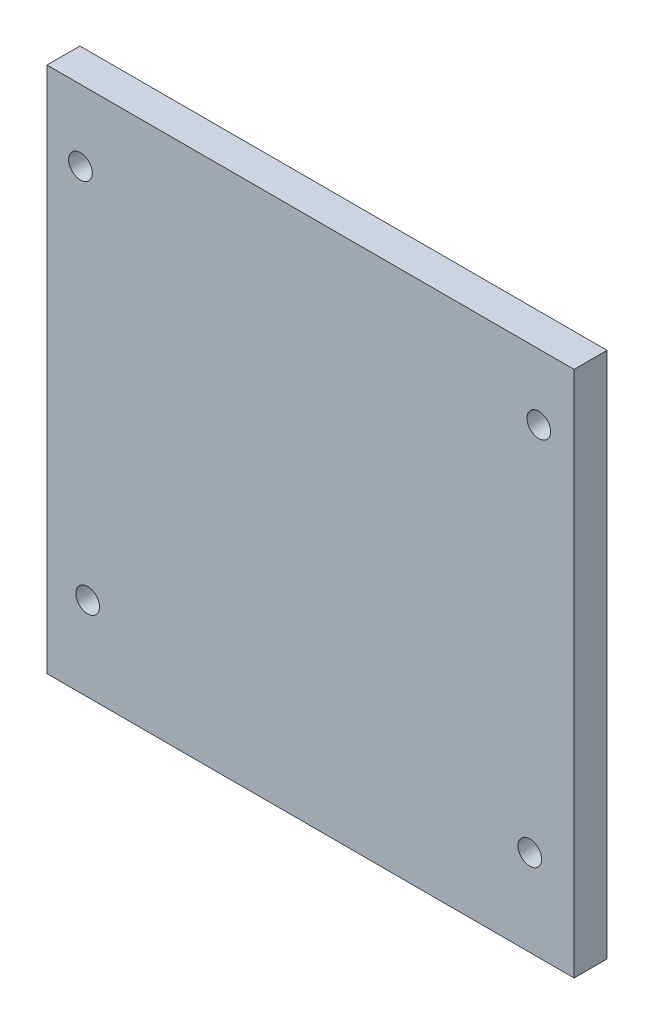
from build123d import *

# Parameters (mm, degrees)
SKETCH1_W           = 101.6
SKETCH1_H           = 101.6
BOSS_EXTRUDE1_DEPTH = 6.35
SKETCH2_R           = 2.286
CUT_EXTRUDE1_DEPTH  = 73.122135992


with BuildPart() as part:
    # Sketch1 → Boss-Extrude1 (new body)
    with BuildSketch(Plane.XY):
        Rectangle(SKETCH1_W, SKETCH1_H)
    extrude(amount=BOSS_EXTRUDE1_DEPTH)

    # Sketch2 → Cut-Extrude1 (cut, through all)
    with BuildSketch(Plane(origin=(0, 0, 0), x_dir=(-1, 0, 0), z_dir=(0, 0, -1))):
        with Locations((-42.259312367, -34.12311472)):
            Circle(SKETCH2_R)
        with Locations((42.95939041, -34.610988475)):
            Circle(SKETCH2_R)
        with Locations((44.353227794, 37.105683547)):
            Circle(SKETCH2_R)
        with Locations((-44.009030347, 38.128511897)):
            Circle(SKETCH2_R)
    extrude(amount=-CUT_EXTRUDE1_DEPTH, mode=Mode.SUBTRACT)


solid = part.part
